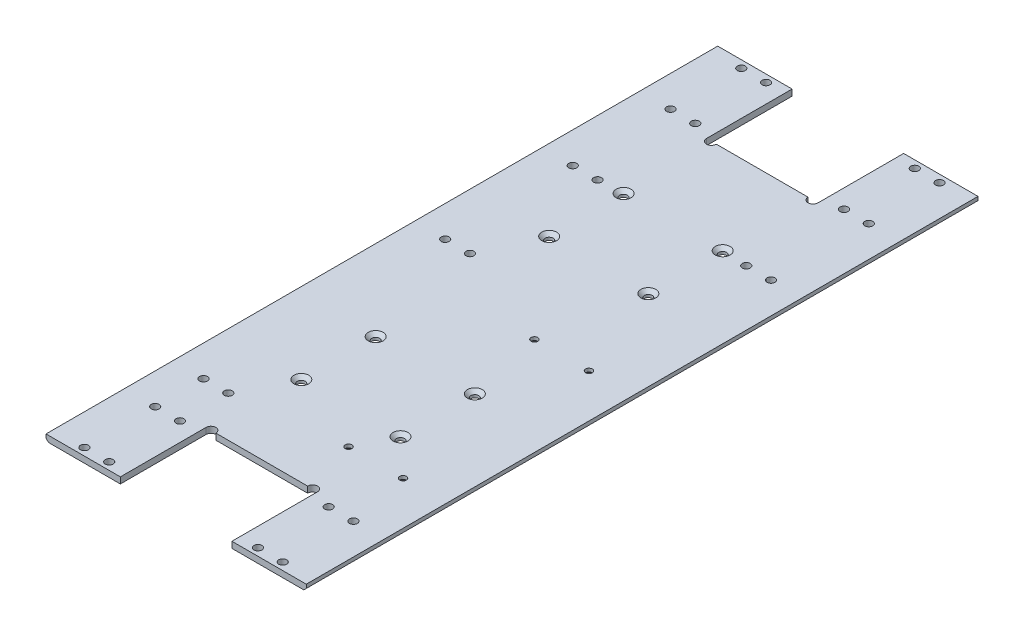
from build123d import *

# Parameters (mm, degrees)
SKETCH_1_W          = 105
SKETCH_1_H          = 271
EXTRUDE_1_DEPTH     = 2.5
SKETCH_2_R          = 1.35
SKETCH_2_R_2        = 1.6
CUT_EXTRUDE_1_DEPTH = 10
CHAMFER_3_SIZE      = 1.15
CHAMFER_4_SIZE      = 1.4
CHAMFER_5_SIZE      = 1
CUT_EXTRUDE_2_DEPTH = 10
SKETCH_6_R          = 1.6
CUT_EXTRUDE_3_DEPTH = 10
SKETCH_7_R          = 1.6
CUT_EXTRUDE_4_DEPTH = 10
SKETCH_8_R          = 1.6
CUT_EXTRUDE_5_DEPTH = 10
SKETCH_9_R          = 2
CUT_EXTRUDE_6_DEPTH = 10


with BuildPart() as part:
    # 草图1 → 凸台-拉伸1 (new body)
    with BuildSketch(Plane(origin=(0, 0, 0), x_dir=(1, 0, 0), z_dir=(0, 1, 0))):
        Rectangle(SKETCH_1_W, SKETCH_1_H)
    extrude(amount=EXTRUDE_1_DEPTH)

    # 草图2 → 切除-拉伸1 (cut)
    with BuildSketch(Plane(origin=(0, 2.5, 0), x_dir=(1, 0, 0), z_dir=(0, 1, 0))):
        with Locations((35, -3.95)):
            Circle(SKETCH_2_R)
        with Locations((13.000000181, -3.95)):
            Circle(SKETCH_2_R)
        with Locations((35, -78.95)):
            Circle(SKETCH_2_R)
        with Locations((13.000000181, -78.95)):
            Circle(SKETCH_2_R)
        with Locations((20, -35)):
            Circle(SKETCH_2_R_2)
        with Locations((-20, -35)):
            Circle(SKETCH_2_R_2)
        with Locations((20, -65)):
            Circle(SKETCH_2_R_2)
        with Locations((-20, -65)):
            Circle(SKETCH_2_R_2)
        with Locations((-20, 35)):
            Circle(SKETCH_2_R_2)
        with Locations((20, 35)):
            Circle(SKETCH_2_R_2)
        with Locations((-20, 65)):
            Circle(SKETCH_2_R_2)
        with Locations((20, 65)):
            Circle(SKETCH_2_R_2)
    extrude(amount=-CUT_EXTRUDE_1_DEPTH, mode=Mode.SUBTRACT)

    # 倒角3
    chamfer_3_edges = [part.edges().sort_by_distance(p)[0] for p in [
        (11.650000181, 0, 3.95),
        (33.65, 0, 3.95),
        (33.65, 0, 78.95),
        (11.650000181, 0, 78.95),
    ]]
    chamfer(chamfer_3_edges, length=CHAMFER_3_SIZE)

    # 倒角4
    chamfer_4_edges = [part.edges().sort_by_distance(p)[0] for p in [
        (-21.6, 2.5, 65),
        (-21.6, 2.5, 35),
        (18.4, 2.5, 65),
        (18.4, 2.5, 35),
        (-21.6, 2.5, -35),
        (-21.6, 2.5, -65),
        (18.4, 2.5, -35),
        (18.4, 2.5, -65),
    ]]
    chamfer(chamfer_4_edges, length=CHAMFER_4_SIZE)

    # 倒角5
    chamfer_5_edges = [part.edges().sort_by_distance(p)[0] for p in [
        (52.5, 0, 0),
        (-52.5, 0, 0),
    ]]
    chamfer(chamfer_5_edges, length=CHAMFER_5_SIZE)

    # 草图4 → 切除-拉伸2 (cut)
    with BuildSketch(Plane.XZ):
        Polygon((0, 100.95), (22.5, 100.95), (22.5, 135.5), (-22.5, 135.5), (-22.5, 100.95), align=None)
        Polygon((-22.5, -100.95), (0, -100.95), (22.5, -100.95), (22.5, -135.5), (-22.5, -135.5), align=None)
    extrude(amount=-CUT_EXTRUDE_2_DEPTH, mode=Mode.SUBTRACT)

    # 草图6 → 切除-拉伸3 (cut)
    with BuildSketch(Plane.XZ):
        with Locations((-40, 132.5)):
            Circle(SKETCH_6_R)
        with Locations((-30, 132.5)):
            Circle(SKETCH_6_R)
        with Locations((-30, 103.95)):
            Circle(SKETCH_6_R)
        with Locations((-40, 103.95)):
            Circle(SKETCH_6_R)
        with Locations((40, 103.95)):
            Circle(SKETCH_6_R)
        with Locations((30, 103.95)):
            Circle(SKETCH_6_R)
        with Locations((30, 132.5)):
            Circle(SKETCH_6_R)
        with Locations((40, 132.5)):
            Circle(SKETCH_6_R)
        with Locations((40, -132.5)):
            Circle(SKETCH_6_R)
        with Locations((30, -132.5)):
            Circle(SKETCH_6_R)
        with Locations((30, -103.95)):
            Circle(SKETCH_6_R)
        with Locations((40, -103.95)):
            Circle(SKETCH_6_R)
        with Locations((-40, -103.95)):
            Circle(SKETCH_6_R)
        with Locations((-30, -103.95)):
            Circle(SKETCH_6_R)
        with Locations((-30, -132.5)):
            Circle(SKETCH_6_R)
        with Locations((-40, -132.5)):
            Circle(SKETCH_6_R)
    extrude(amount=-CUT_EXTRUDE_3_DEPTH, mode=Mode.SUBTRACT)

    # 草图7 → 切除-拉伸4 (cut)
    with BuildSketch(Plane(origin=(0, 2.5, 0), x_dir=(1, 0, 0), z_dir=(0, 1, 0))):
        with Locations((-40, 64.5)):
            Circle(SKETCH_7_R)
        with Locations((-30, 64.5)):
            Circle(SKETCH_7_R)
        with Locations((30, 64.5)):
            Circle(SKETCH_7_R)
        with Locations((40, 64.5)):
            Circle(SKETCH_7_R)
    extrude(amount=-CUT_EXTRUDE_4_DEPTH, mode=Mode.SUBTRACT)

    # 草图8 → 切除-拉伸5 (cut)
    with BuildSketch(Plane.XZ):
        with Locations((-40, 84.45)):
            Circle(SKETCH_8_R)
        with Locations((-30, 84.45)):
            Circle(SKETCH_8_R)
        with Locations((-40, -13.05)):
            Circle(SKETCH_8_R)
        with Locations((-30, -13.05)):
            Circle(SKETCH_8_R)
    extrude(amount=-CUT_EXTRUDE_5_DEPTH, mode=Mode.SUBTRACT)

    # 草图9 → 切除-拉伸6 (cut)
    with BuildSketch(Plane.XZ):
        with Locations((20.5, 100.95)):
            Circle(SKETCH_9_R)
        with Locations((-20.5, 100.95)):
            Circle(SKETCH_9_R)
        with Locations((-20.5, -100.95)):
            Circle(SKETCH_9_R)
        with Locations((20.5, -100.95)):
            Circle(SKETCH_9_R)
    extrude(amount=-CUT_EXTRUDE_6_DEPTH, mode=Mode.SUBTRACT)


solid = part.part
